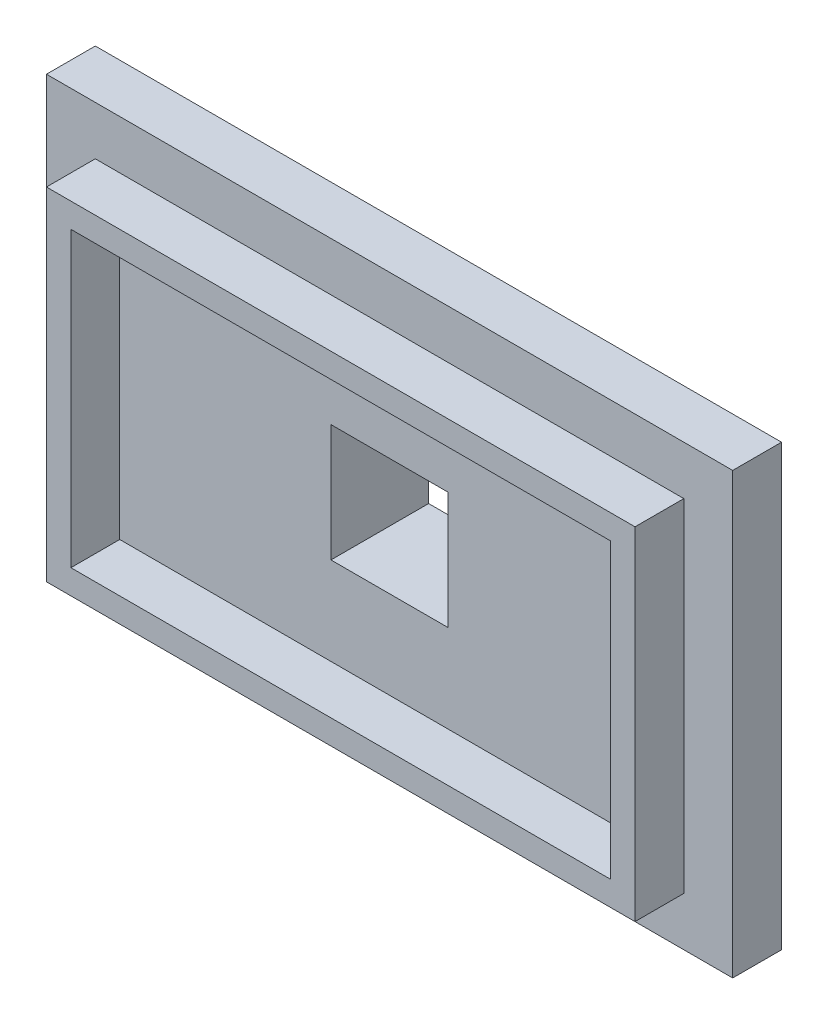
from build123d import *

# Parameters (mm, degrees)
SKETCH1_W                = 356.84968
SKETCH1_H                = 228.6
SKETCH1_W_2              = 306.04968
SKETCH1_H_2              = 177.8
BOSS_EXTRUDE1_DEPTH      = 25.4
BOSS_EXTRUDE2_DEPTH      = 25.4
BOSS_EXTRUDE2_DEPTH_BACK = 25.4
SKETCH1_3_W              = 306.04968
SKETCH1_3_H              = 177.8
SKETCH2_W                = 60.96
SKETCH2_H                = 60.96
CUT_EXTRUDE1_DEPTH       = 218.900329346
SKETCH3_W                = 306.04968
SKETCH3_H                = 177.8
SKETCH3_W_2              = 280.64968
SKETCH3_H_2              = 152.4
BOSS_EXTRUDE3_DEPTH      = 25.4


with BuildPart() as part:
    # Sketch1 → Boss-Extrude1 (new body)
    with BuildSketch(Plane.XY):
        Rectangle(SKETCH1_W, SKETCH1_H)
        Rectangle(SKETCH1_W_2, SKETCH1_H_2, mode=Mode.SUBTRACT)
    extrude(amount=BOSS_EXTRUDE1_DEPTH)

    # Sketch1<3> → Boss-Extrude2 (add, two sides: drawn at the far end of the back side and taken through both)
    with BuildSketch(Plane.XY.offset(-BOSS_EXTRUDE2_DEPTH_BACK)):
        Rectangle(SKETCH1_3_W, SKETCH1_3_H)
    extrude(amount=BOSS_EXTRUDE2_DEPTH + BOSS_EXTRUDE2_DEPTH_BACK)

    # Sketch2 → Cut-Extrude1 (cut, through all)
    with BuildSketch(Plane(origin=(0, 0, -25.4), x_dir=(-1, 0, 0), z_dir=(0, 0, -1))):
        Rectangle(SKETCH2_W, SKETCH2_H)
    extrude(amount=-CUT_EXTRUDE1_DEPTH, mode=Mode.SUBTRACT)

    # Sketch3 → Boss-Extrude3 (add)
    with BuildSketch(Plane.XY.offset(25.4)):
        Rectangle(SKETCH3_W, SKETCH3_H)
        Rectangle(SKETCH3_W_2, SKETCH3_H_2, mode=Mode.SUBTRACT)
    extrude(amount=BOSS_EXTRUDE3_DEPTH)


solid = part.part
